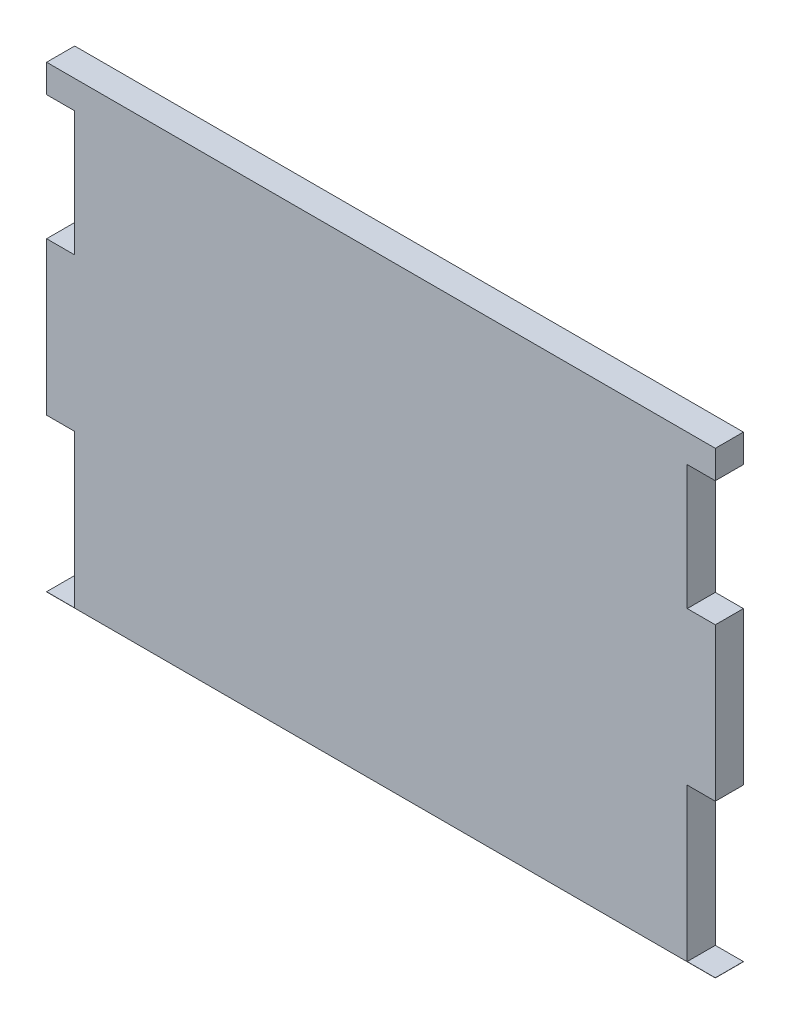
from build123d import *

# Parameters (mm, degrees)
SKETCH2_W           = 127
SKETCH2_H           = 152.4
BOSS_EXTRUDE2_DEPTH = 5.334
SKETCH3_W           = 127
SKETCH3_H           = 65.278
CUT_EXTRUDE1_DEPTH  = 100.333486579
CAVITY1_START       = -76.163714286
CAVITY1_OUTLINE_W   = 5.334
CAVITY1_OUTLINE_H   = 5.334
CAVITY1_DEPTH       = 29.028571429
CAVITY1_START_2     = -18.106571429
CAVITY1_2_OUTLINE_W = 5.334
CAVITY1_2_OUTLINE_H = 5.334
CAVITY1_2_DEPTH     = 23.694571429


# Read off the part's stored shape, not the designer's step: Cavity1
with BuildPart() as part:
    # Sketch2 → Boss-Extrude2 (new body)
    with BuildSketch(Plane.XY):
        Rectangle(SKETCH2_W, SKETCH2_H)
    extrude(amount=BOSS_EXTRUDE2_DEPTH)

    # Sketch3 → Cut-Extrude1 (cut, through all)
    with BuildSketch(Plane.XY.offset(5.334)):
        with Locations((0, 43.561)):
            Rectangle(SKETCH3_W, SKETCH3_H)
    extrude(amount=-CUT_EXTRUDE1_DEPTH, mode=Mode.SUBTRACT)

    # Cavity1 outline → Cavity1 (cut)
    with BuildSketch(Plane(origin=(0, 0, 0), x_dir=(1, 0, 0), z_dir=(0, 1, 0)).offset(CAVITY1_START)):
        with Locations((60.833, -2.667)):
            Rectangle(CAVITY1_OUTLINE_W, CAVITY1_OUTLINE_H)
        with Locations((-60.833, -2.667)):
            Rectangle(CAVITY1_OUTLINE_W, CAVITY1_OUTLINE_H)
    extrude(amount=CAVITY1_DEPTH, mode=Mode.SUBTRACT)

    # Cavity1 2 outline → Cavity1 2 (cut)
    with BuildSketch(Plane(origin=(0, 0, 0), x_dir=(1, 0, 0), z_dir=(0, 1, 0)).offset(CAVITY1_START_2)):
        with Locations((60.833, -2.667)):
            Rectangle(CAVITY1_2_OUTLINE_W, CAVITY1_2_OUTLINE_H)
        with Locations((-60.833, -2.667)):
            Rectangle(CAVITY1_2_OUTLINE_W, CAVITY1_2_OUTLINE_H)
    extrude(amount=CAVITY1_2_DEPTH, mode=Mode.SUBTRACT)


solid = part.part
